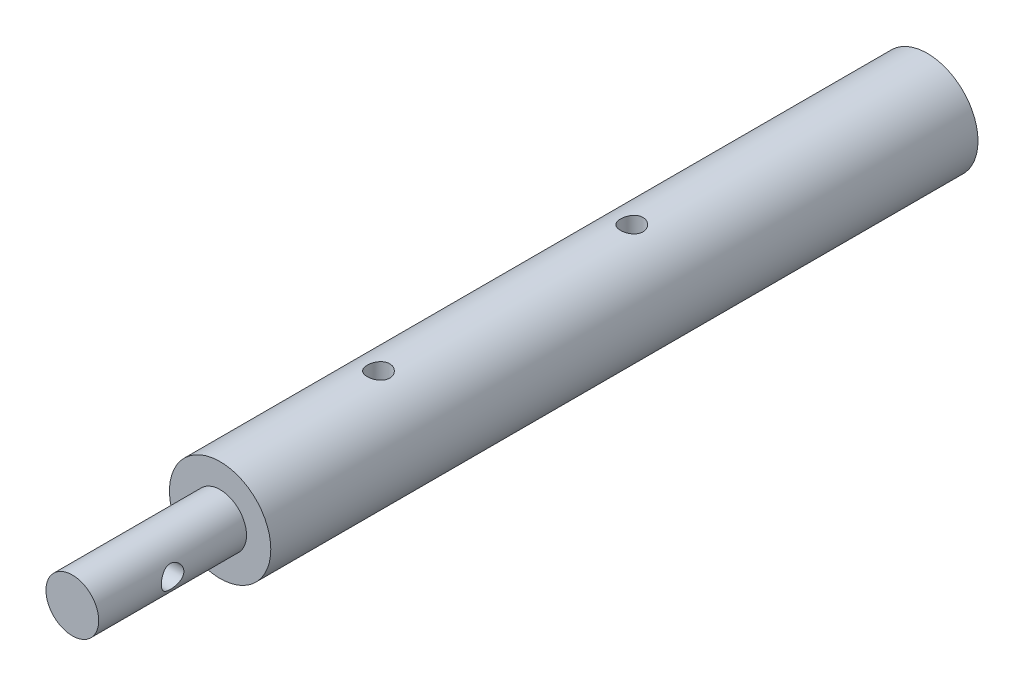
from build123d import *

# Parameters (mm, degrees)
SKETCH1_R             = 6.096
BOSS_EXTRUDE1_DEPTH   = 85.09
SKETCH2_R             = 3.175
BOSS_EXTRUDE2_DEPTH   = 17.78
F_6_32_TAPPED_HOLE1_D = 2.7051
F_6_32_TAPPED_HOLE2_D = 2.7051


with BuildPart() as part:
    # Sketch1 → Boss-Extrude1 (new body)
    with BuildSketch(Plane.XY):
        Circle(SKETCH1_R)
    extrude(amount=BOSS_EXTRUDE1_DEPTH)

    # Sketch2 → Boss-Extrude2 (add)
    with BuildSketch(Plane.XY.offset(85.09)):
        Circle(SKETCH2_R)
    extrude(amount=BOSS_EXTRUDE2_DEPTH)

    # #6-32 Tapped Hole1 (through all)
    with Locations(Plane(origin=(0, 6.096, 0), x_dir=(1, 0, 0), z_dir=(0, 1, 0))):
        with Locations((0, -35.56), (0, -66.04)):
            Hole(F_6_32_TAPPED_HOLE1_D / 2)

    # #6-32 Tapped Hole2 (through all)
    with Locations(Plane(origin=(3.175, 0, 0), x_dir=(0, 0, -1), z_dir=(1, 0, 0))):
        with Locations((-93.98, 0)):
            Hole(F_6_32_TAPPED_HOLE2_D / 2)


solid = part.part
